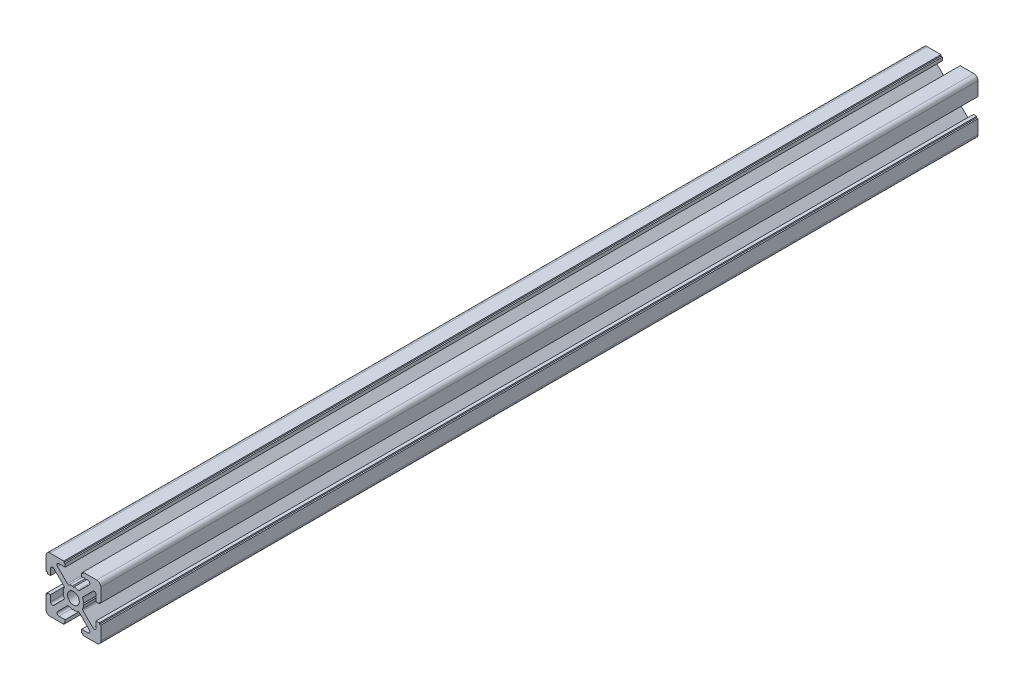
from build123d import *

# Parameters (mm, degrees)
SKETCH1_R           = 2.15
BOSS_EXTRUDE1_DEPTH = 320


with BuildPart() as part:
    # Sketch1 → Boss-Extrude1 (new body)
    with BuildSketch(Plane.XY.offset(330)):
        with BuildLine():
            Line((-3.499999948, -10), (-3.499999948, -9.5))
            Line((-3.499999948, -9.5), (-2.999999948, -9.5))
            Line((-2.999999948, -9.5), (-2.999999948, -8.299999966))
            Line((-2.999999948, -8.299999966), (-5.299390249, -8.299999966))
            ThreePointArc((-5.299390249, -8.299999966), (-5.946105921, -7.86787837), (-5.794364998, -7.105025221))
            Line((-5.794364998, -7.105025221), (-2.175465548, -3.48612574))
            ThreePointArc((-2.175465548, -3.48612574), (-1.907085057, -3.346986956), (-1.607569547, -3.387952169))
            ThreePointArc((-1.607569547, -3.387952169), (-0.96970891, -3.622452814), (-0.299999981, -3.73798071))
            Line((-0.299999981, -3.73798071), (1.9e-08, -3.449999972))
            Line((1.9e-08, -3.449999972), (0.300000019, -3.737980711))
            ThreePointArc((0.300000019, -3.737980711), (0.969708957, -3.622452812), (1.607569601, -3.387952162))
            ThreePointArc((1.607569601, -3.387952162), (1.90708511, -3.346986948), (2.175465602, -3.48612573))
            Line((2.175465602, -3.48612573), (5.794365084, -7.105025212))
            ThreePointArc((5.794365084, -7.105025212), (5.946106011, -7.867878366), (5.299390334, -8.299999966))
            Line((5.299390334, -8.299999966), (2.999999948, -8.299999966))
            Line((2.999999948, -8.299999966), (2.999999948, -9.5))
            Line((2.999999948, -9.5), (3.499999948, -9.5))
            Line((3.499999948, -9.5), (3.499999948, -10))
            Line((3.499999948, -10), (8.499999948, -10))
            ThreePointArc((8.499999948, -10), (9.56066012, -9.560660172), (9.999999948, -8.5))
            Line((9.999999948, -8.5), (9.999999948, -3.5))
            Line((9.999999948, -3.5), (9.499999948, -3.5))
            Line((9.499999948, -3.5), (9.499999948, -3))
            Line((9.499999948, -3), (8.299999978, -3))
            Line((8.299999978, -3), (8.299999978, -5.299390319))
            ThreePointArc((8.299999978, -5.299390319), (7.867878379, -5.946105992), (7.105025229, -5.794365063))
            Line((7.105025229, -5.794365063), (3.486125768, -2.17546557))
            ThreePointArc((3.486125768, -2.17546557), (3.346986986, -1.907085078), (3.387952202, -1.607569568))
            ThreePointArc((3.387952202, -1.607569568), (3.622452857, -0.969708918), (3.737980757, -0.299999973))
            Line((3.737980757, -0.299999973), (3.450000019, 2.8e-08))
            Line((3.450000019, 2.8e-08), (3.737980758, 0.300000028))
            ThreePointArc((3.737980758, 0.300000028), (3.622452857, 0.969708973), (3.387952202, 1.607569624))
            ThreePointArc((3.387952202, 1.607569624), (3.346986986, 1.907085133), (3.486125768, 2.175465626))
            Line((3.486125768, 2.175465626), (7.105025231, 5.794365121))
            ThreePointArc((7.105025231, 5.794365121), (7.86787838, 5.94610605), (8.299999978, 5.299390377))
            Line((8.299999978, 5.299390377), (8.299999978, 3))
            Line((8.299999978, 3), (9.499999948, 3))
            Line((9.499999948, 3), (9.499999948, 3.5))
            Line((9.499999948, 3.5), (9.999999948, 3.5))
            Line((9.999999948, 3.5), (9.999999948, 8.5))
            ThreePointArc((9.999999948, 8.5), (9.56066012, 9.560660172), (8.499999948, 10))
            Line((8.499999948, 10), (3.499999948, 10))
            Line((3.499999948, 10), (3.499999948, 9.5))
            Line((3.499999948, 9.5), (2.999999948, 9.5))
            Line((2.999999948, 9.5), (2.999999948, 8.300000022))
            Line((2.999999948, 8.300000022), (5.299390294, 8.300000022))
            ThreePointArc((5.299390294, 8.300000022), (5.946105963, 7.867878428), (5.794365041, 7.105025282))
            Line((5.794365041, 7.105025282), (2.175465586, 3.486125796))
            ThreePointArc((2.175465586, 3.486125796), (1.907085095, 3.346987012), (1.607569585, 3.387952225))
            ThreePointArc((1.607569585, 3.387952225), (0.969708948, 3.62245287), (0.300000018, 3.737980766))
            Line((0.300000018, 3.737980766), (1.9e-08, 3.450000028))
            Line((1.9e-08, 3.450000028), (-0.299999982, 3.737980766))
            ThreePointArc((-0.299999982, 3.737980766), (-0.969708911, 3.62245287), (-1.607569547, 3.387952225))
            ThreePointArc((-1.607569547, 3.387952225), (-1.907085057, 3.346987012), (-2.175465548, 3.486125796))
            Line((-2.175465548, 3.486125796), (-5.794364998, 7.105025277))
            ThreePointArc((-5.794364998, 7.105025277), (-5.946105921, 7.867878426), (-5.299390249, 8.300000022))
            Line((-5.299390249, 8.300000022), (-2.999999948, 8.300000022))
            Line((-2.999999948, 8.300000022), (-2.999999948, 9.5))
            Line((-2.999999948, 9.5), (-3.499999948, 9.5))
            Line((-3.499999948, 9.5), (-3.499999948, 10))
            Line((-3.499999948, 10), (-8.499999948, 10))
            ThreePointArc((-8.499999948, 10), (-9.56066012, 9.560660172), (-9.999999948, 8.5))
            Line((-9.999999948, 8.5), (-9.999999948, 3.5))
            Line((-9.999999948, 3.5), (-9.499999948, 3.5))
            Line((-9.499999948, 3.5), (-9.499999948, 3))
            Line((-9.499999948, 3), (-8.29999994, 3))
            Line((-8.29999994, 3), (-8.29999994, 5.299390329))
            ThreePointArc((-8.29999994, 5.299390329), (-7.867878345, 5.946105998), (-7.105025201, 5.794365073))
            Line((-7.105025201, 5.794365073), (-3.486125739, 2.175465611))
            ThreePointArc((-3.486125739, 2.175465611), (-3.346986957, 1.907085119), (-3.387952171, 1.607569609))
            ThreePointArc((-3.387952171, 1.607569609), (-3.622452821, 0.969708966), (-3.737980719, 0.300000029))
            Line((-3.737980719, 0.300000029), (-3.449999981, 2.8e-08))
            Line((-3.449999981, 2.8e-08), (-3.737980719, -0.299999971))
            ThreePointArc((-3.737980719, -0.299999971), (-3.622452819, -0.969708917), (-3.387952164, -1.607569568))
            ThreePointArc((-3.387952164, -1.607569568), (-3.346986948, -1.907085078), (-3.486125729, -2.17546557))
            Line((-3.486125729, -2.17546557), (-7.105025191, -5.794365063))
            ThreePointArc((-7.105025191, -5.794365063), (-7.867878341, -5.946105992), (-8.29999994, -5.299390319))
            Line((-8.29999994, -5.299390319), (-8.29999994, -3))
            Line((-8.29999994, -3), (-9.499999948, -3))
            Line((-9.499999948, -3), (-9.499999948, -3.5))
            Line((-9.499999948, -3.5), (-9.999999948, -3.5))
            Line((-9.999999948, -3.5), (-9.999999948, -8.5))
            ThreePointArc((-9.999999948, -8.5), (-9.56066012, -9.560660172), (-8.499999948, -10))
            Line((-8.499999948, -10), (-3.499999948, -10))
        make_face()
        with Locations((1.9e-08, 2.8e-08)):
            Circle(SKETCH1_R, mode=Mode.SUBTRACT)
    extrude(amount=-BOSS_EXTRUDE1_DEPTH)


solid = part.part
